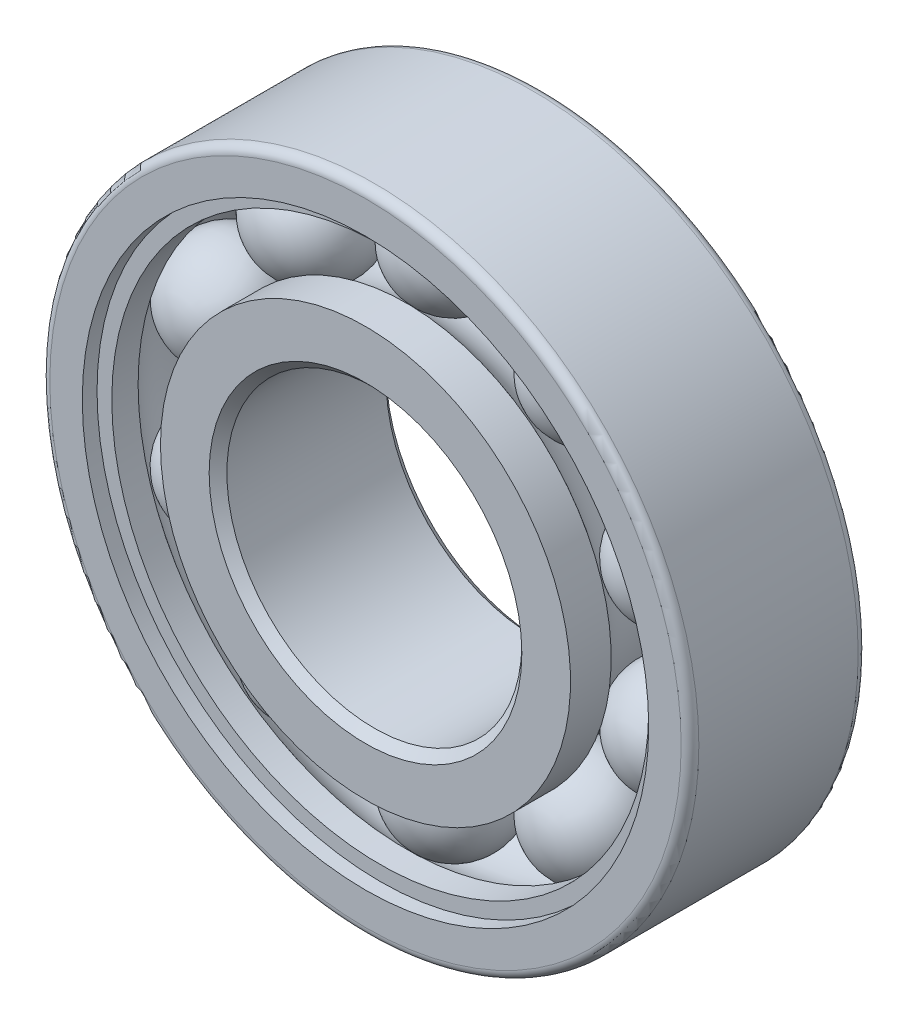
from build123d import *

# Parameters (mm, degrees)
CIRPATTERN3_COUNT  = 10
SKETCH10_R         = 9.6
SKETCH10_R_2       = 9.1
CUT_EXTRUDE1_DEPTH = 0.5
FILLET1_R          = 0.3
CHAMFER1_SIZE      = 0.3


with BuildPart() as part:
    # Sketch6 → Revolve2 (revolve)
    with BuildSketch(Plane(origin=(0, 0, 0), x_dir=(0, 0, -1), z_dir=(1, 0, 0))):
        with BuildLine():
            Line((3, 9.1), (3, 11))
            Line((3, 11), (-3, 11))
            Line((-3, 11), (-3, 9.1))
            Line((-3, 9.1), (-1.608297601, 9.1))
            ThreePointArc((-1.608297601, 9.1), (0, 9.955050006), (1.608297601, 9.1))
            Line((1.608297601, 9.1), (3, 9.1))
        make_face()
        with BuildLine():
            ThreePointArc((1.621651102, 6.95), (0, 6.074889007), (-1.621651102, 6.95))
            Line((-1.621651102, 6.95), (-3, 6.95))
            Line((-3, 6.95), (-3, 5))
            Line((-3, 5), (3, 5))
            Line((3, 5), (3, 6.95))
            Line((3, 6.95), (1.621651102, 6.95))
        make_face()
    revolve(axis=Axis((0, 0, 0), (0, 0, 1)))

    # Sketch10 → Cut-Extrude1 (cut)
    with BuildSketch(Plane(origin=(0, 0, -3), x_dir=(-1, 0, 0), z_dir=(0, 0, -1))):
        Circle(SKETCH10_R)
        Circle(SKETCH10_R_2, mode=Mode.SUBTRACT)
    cut_extrude1 = extrude(amount=-CUT_EXTRUDE1_DEPTH, mode=Mode.SUBTRACT)

    # Mirror1: Cut-Extrude1 across plane
    add(cut_extrude1.mirror(Plane.XY), mode=Mode.SUBTRACT)

    # Fillet1
    fillet1_edges = [part.edges().sort_by_distance(p)[0] for p in [
        (0, -11, -3),
        (0, -11, 3),
    ]]
    fillet(fillet1_edges, radius=FILLET1_R)

    # Chamfer1
    chamfer1_edges = [part.edges().sort_by_distance(p)[0] for p in [
        (0, -5, -3),
        (0, -5, 3),
    ]]
    chamfer(chamfer1_edges, length=CHAMFER1_SIZE)


with BuildPart() as body_2:
    # Sketch9 → Revolve3 (revolve)
    with BuildSketch(Plane(origin=(0, 0, 0), x_dir=(0, 0, -1), z_dir=(1, 0, 0))):
        with BuildLine():
            ThreePointArc((1.9, 8.01), (0, 9.91), (-1.9, 8.01))
            Line((-1.9, 8.01), (1.9, 8.01))
        make_face()
    revolve(axis=Axis((0, 8.01, 1.9), (0, 0, -1)))


with BuildPart() as cirpattern3_1:
    # CirPattern3: pattern copy
    add(body_2.part.rotate(Axis((0, 0, 3), (0, 0, -1)), 1 * 360 / CIRPATTERN3_COUNT))


with BuildPart() as cirpattern3_2:
    # CirPattern3: pattern copy
    add(body_2.part.rotate(Axis((0, 0, 3), (0, 0, -1)), 2 * 360 / CIRPATTERN3_COUNT))


with BuildPart() as cirpattern3_3:
    # CirPattern3: pattern copy
    add(body_2.part.rotate(Axis((0, 0, 3), (0, 0, -1)), 3 * 360 / CIRPATTERN3_COUNT))


with BuildPart() as cirpattern3_4:
    # CirPattern3: pattern copy
    add(body_2.part.rotate(Axis((0, 0, 3), (0, 0, -1)), 4 * 360 / CIRPATTERN3_COUNT))


with BuildPart() as cirpattern3_5:
    # CirPattern3: pattern copy
    add(body_2.part.rotate(Axis((0, 0, 3), (0, 0, -1)), 5 * 360 / CIRPATTERN3_COUNT))


with BuildPart() as cirpattern3_6:
    # CirPattern3: pattern copy
    add(body_2.part.rotate(Axis((0, 0, 3), (0, 0, -1)), 6 * 360 / CIRPATTERN3_COUNT))


with BuildPart() as cirpattern3_7:
    # CirPattern3: pattern copy
    add(body_2.part.rotate(Axis((0, 0, 3), (0, 0, -1)), 7 * 360 / CIRPATTERN3_COUNT))


with BuildPart() as cirpattern3_8:
    # CirPattern3: pattern copy
    add(body_2.part.rotate(Axis((0, 0, 3), (0, 0, -1)), 8 * 360 / CIRPATTERN3_COUNT))


with BuildPart() as cirpattern3_9:
    # CirPattern3: pattern copy
    add(body_2.part.rotate(Axis((0, 0, 3), (0, 0, -1)), 9 * 360 / CIRPATTERN3_COUNT))


solid = Compound([part.part, body_2.part, cirpattern3_1.part, cirpattern3_2.part, cirpattern3_3.part, cirpattern3_4.part, cirpattern3_5.part, cirpattern3_6.part, cirpattern3_7.part, cirpattern3_8.part, cirpattern3_9.part])
